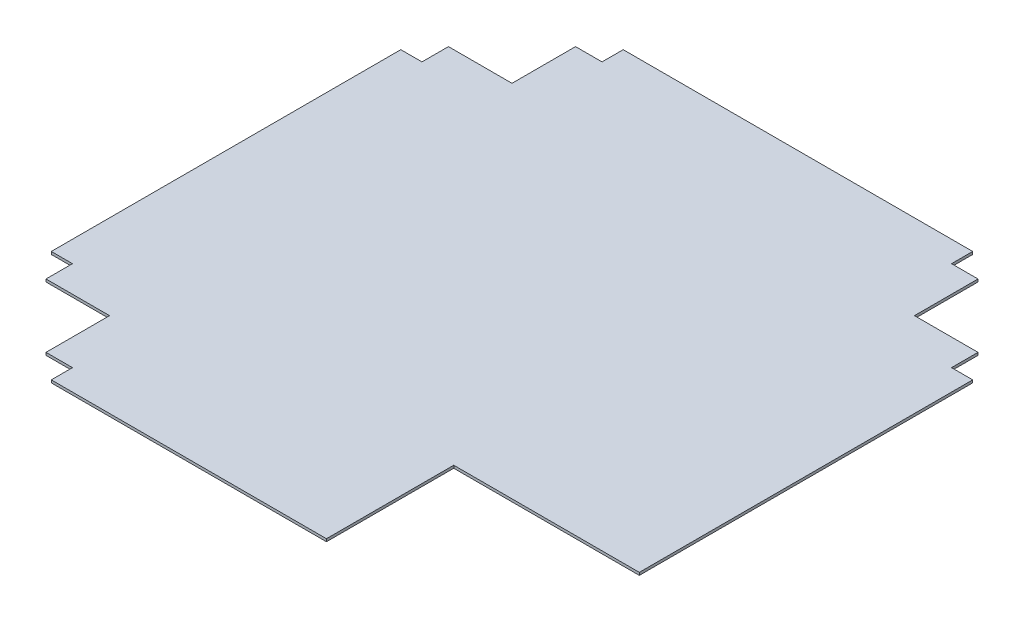
from build123d import *

# Parameters (mm, degrees)
SKETCH1_W           = 685.8
SKETCH1_H           = 685.8
BOSS_EXTRUDE1_DEPTH = 3.175
CUT_EXTRUDE1_DEPTH  = 485.944224241
SKETCH4_W           = 266.7
SKETCH4_H           = 165.1
CUT_EXTRUDE2_DEPTH  = 485.944224241


with BuildPart() as part:
    # Sketch1 → Boss-Extrude1 (new body)
    with BuildSketch(Plane(origin=(0, 0, 0), x_dir=(1, 0, 0), z_dir=(0, 1, 0))):
        Rectangle(SKETCH1_W, SKETCH1_H)
    extrude(amount=BOSS_EXTRUDE1_DEPTH)

    # Sketch3 → Cut-Extrude1 (cut, through all)
    with BuildSketch(Plane(origin=(0, 3.175, 0), x_dir=(1, 0, 0), z_dir=(0, 1, 0))):
        Polygon((-342.9, 342.9), (-209.55, 342.9), (-209.55, 317.5), (-241.3, 317.5), (-241.3, 241.3), (-317.5, 241.3), (-317.5, 209.55), (-342.9, 209.55), align=None)
        Polygon((317.5, 241.3), (317.5, 209.55), (342.9, 209.55), (342.9, 342.9), (209.55, 342.9), (209.55, 317.5), (241.3, 317.5), (241.3, 241.3), align=None)
        Polygon((342.9, -342.9), (209.55, -342.9), (209.55, -317.5), (241.3, -317.5), (241.3, -241.3), (317.5, -241.3), (317.5, -209.55), (342.9, -209.55), align=None)
        Polygon((-317.5, -241.3), (-317.5, -209.55), (-342.9, -209.55), (-342.9, -342.9), (-209.55, -342.9), (-209.55, -317.5), (-241.3, -317.5), (-241.3, -241.3), align=None)
    extrude(amount=-CUT_EXTRUDE1_DEPTH, mode=Mode.SUBTRACT)

    # Sketch4 → Cut-Extrude2 (cut, through all)
    with BuildSketch(Plane(origin=(0, 3.175, 0), x_dir=(1, 0, 0), z_dir=(0, 1, 0))):
        with Locations((253.746, -272.796)):
            Rectangle(SKETCH4_W, SKETCH4_H)
    extrude(amount=-CUT_EXTRUDE2_DEPTH, mode=Mode.SUBTRACT)


solid = part.part
